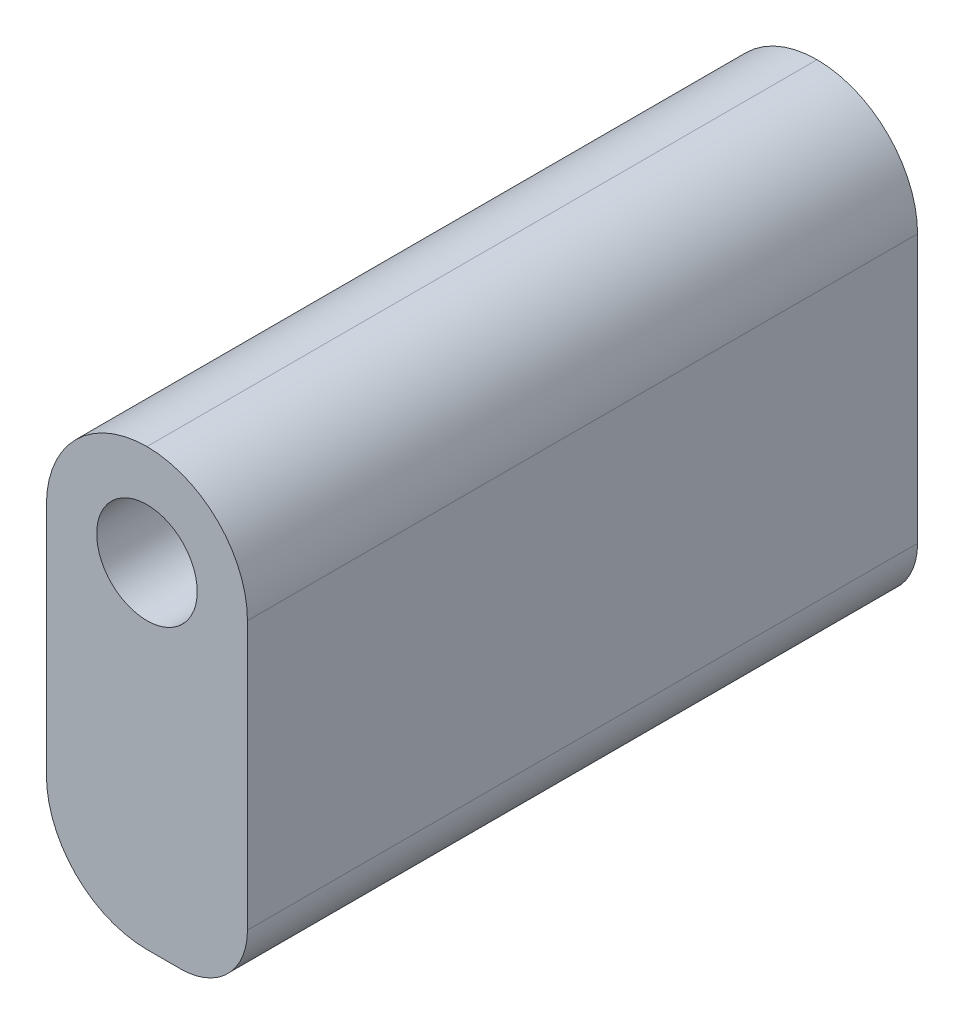
from build123d import *

# Parameters (mm, degrees)
SKETCH1_W           = 12
SKETCH1_H           = 26
SKETCH1_R           = 3
BOSS_EXTRUDE1_DEPTH = 20
FILLET1_R           = 6
FILLET2_R           = 4


with BuildPart() as part:
    # Sketch1 → Boss-Extrude1 (new, symmetric)
    with BuildSketch(Plane.XY):
        with Locations((0, -7)):
            Rectangle(SKETCH1_W, SKETCH1_H)
        Circle(SKETCH1_R, mode=Mode.SUBTRACT)
    extrude(amount=BOSS_EXTRUDE1_DEPTH, both=True)

    # Fillet1
    fillet1_edges = [part.edges().sort_by_distance(p)[0] for p in [
        (-6, -20, 0),
        (6, 6, 0),
        (-6, 6, 0),
    ]]
    fillet(fillet1_edges, radius=FILLET1_R - 0.0001)  # a hair under: the kernel refuses the full size

    # Fillet2
    fillet2_edges = [part.edges().sort_by_distance(p)[0] for p in [
        (6, -20, 0),
    ]]
    fillet(fillet2_edges, radius=FILLET2_R)


solid = part.part
